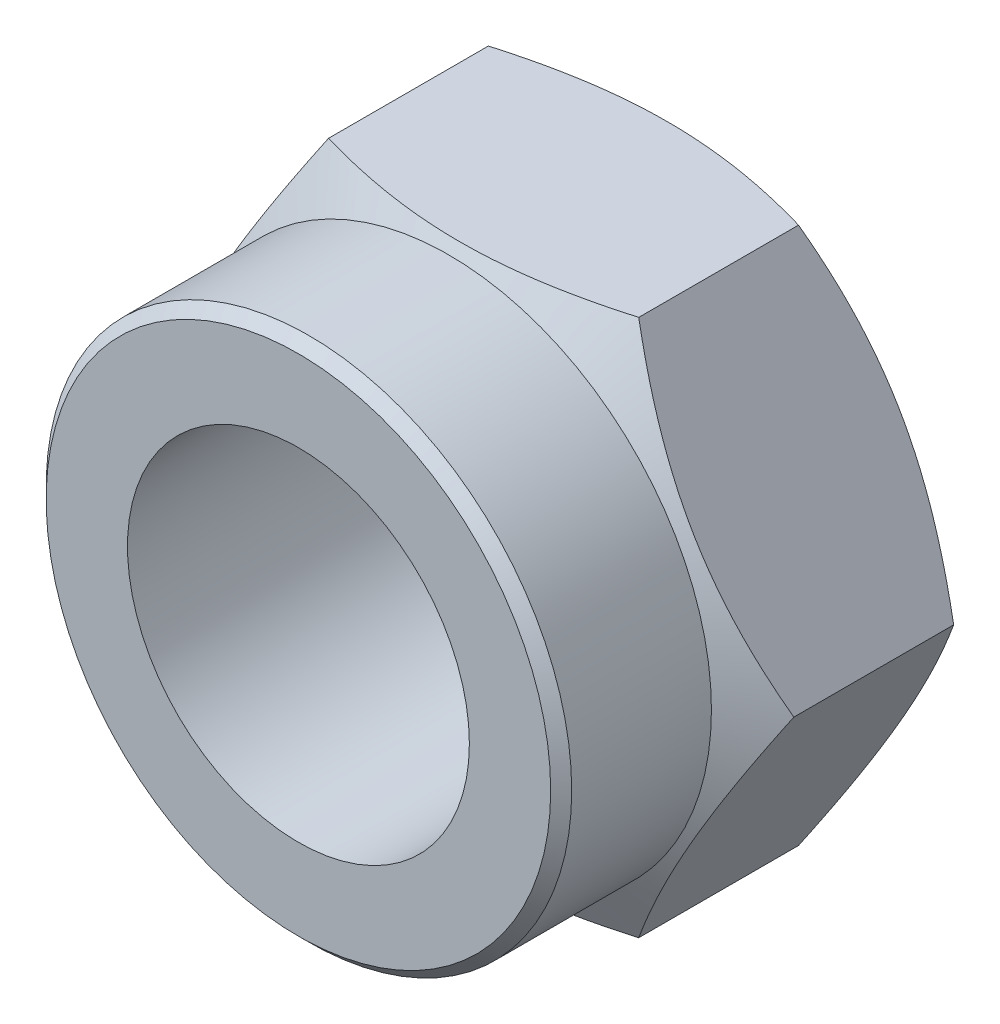
from build123d import *

# Parameters (mm, degrees)
SKETCH1_R      = 17.5
BASENUT_DEPTH  = 23.52
EXTRUDE1_START = 15.38
SKETCH2_R      = 26.9
SKETCH2_R_2    = 17.5
EXTRUDE1_DEPTH = 15.38


with BuildPart() as part:
    # Sketch1 → BaseNut (new body)
    with BuildSketch(Plane.XY):
        Polygon((15.877132403, -27.5), (31.754264805, 0), (15.877132403, 27.5), (-15.877132403, 27.5), (-31.754264805, 0), (-15.877132403, -27.5), align=None)
        Circle(SKETCH1_R, mode=Mode.SUBTRACT)
    extrude(amount=-BASENUT_DEPTH)

    # Sketch3 → Double-Chamfer (revolve, cut)
    with BuildSketch(Plane(origin=(0, 0, 0), x_dir=(1, 0, 0), z_dir=(0, 1, 0)), mode=Mode.PRIVATE) as double_chamfer_sk:
        Polygon((25.555, 23.52), (31.754264805, 23.52), (31.754264805, 19.940852796), align=None)
        Polygon((31.754264805, 3.579147204), (25.555, 0), (31.754264805, 0), align=None)
    revolve(double_chamfer_sk.sketch.rotate(Axis((0, 0, -16.31077227), (0, 0, 1)), 180.000000002), axis=Axis((0, 0, -16.31077227), (0, 0, 1)), mode=Mode.SUBTRACT)

    # Sketch2 → Extrude1 (add)
    with BuildSketch(Plane(origin=(20.087129569, -4.281493882, 0), x_dir=(1, 0, 0), z_dir=(0, 0, 1)).offset(EXTRUDE1_START)):
        with Locations((-20.087129569, 4.281493882)):
            Circle(SKETCH2_R)
        with Locations((-20.087129569, 4.281493882)):
            Circle(SKETCH2_R_2, mode=Mode.SUBTRACT)
    extrude(amount=-EXTRUDE1_DEPTH)

    # Sketch5 → EndChamfer (revolve, cut)
    with BuildSketch(Plane(origin=(0, 0, 0), x_dir=(1, 0, 0), z_dir=(0, 1, 0))):
        Polygon((17.5, 23.52), (19.45, 23.52), (17.5, 21.57), align=None)
    revolve(axis=Axis((0, 0, -16.800797033), (0, 0, 1)), mode=Mode.SUBTRACT)

    # Chamfer1: read off the stored shape, not the designer's step
    # Chamfer1 outline → Chamfer1 (revolve, cut)
    with BuildSketch(Plane.XZ):
        Polygon((26.9, 15.38), (25.824, 15.38), (26.9, 14.304), align=None)
    revolve(axis=Axis((0, 0, 0), (0, 0, 1)), mode=Mode.SUBTRACT)


solid = part.part
